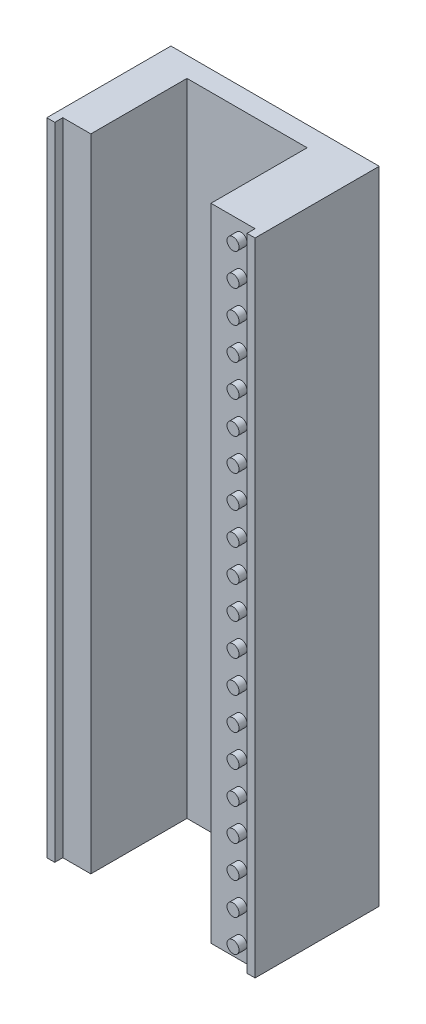
from build123d import *

# Parameters (mm, degrees)
PROFILE_EXTRUDE_DEPTH  = 80
SPROCKET_SKETCH_R      = 0.75
SPROCKET_EXTRUDE_DEPTH = 1
SPROCKET_PATTERN_COUNT = 20
SPROCKET_PATTERN_PITCH = 4


with BuildPart() as part:
    # Profile Sketch → Profile Extrude (new body)
    with BuildSketch(Plane(origin=(0.045617437, 0, -0.024209872), x_dir=(-1, 0, 0), z_dir=(0, 1, 0))):
        Polygon((5.545617437, -11.975790128), (5.545617437, 0.024209872), (0.045617437, 0.024209872), (0.045617437, 1.024209872), (-0.954382563, 1.024209872), (-0.954382563, -14.475790128), (25.045617437, -14.475790128), (25.045617437, 1.024209872), (24.045617437, 1.024209872), (24.045617437, 0.024209872), (20.545617437, 0.024209872), (20.545617437, -11.975790128), align=None)
    extrude(amount=PROFILE_EXTRUDE_DEPTH)

    # Sprocket Sketch → Sprocket Extrude (add)
    with BuildSketch(Plane.XY):
        with Locations((-1.75, 2)):
            Circle(SPROCKET_SKETCH_R)
    sprocket_extrude = extrude(amount=SPROCKET_EXTRUDE_DEPTH)

    # Sprocket Pattern: Sprocket Extrude ×20
    with Locations(*[(0, i * SPROCKET_PATTERN_PITCH, 0) for i in range(1, SPROCKET_PATTERN_COUNT)]):
        add(sprocket_extrude)


solid = part.part
